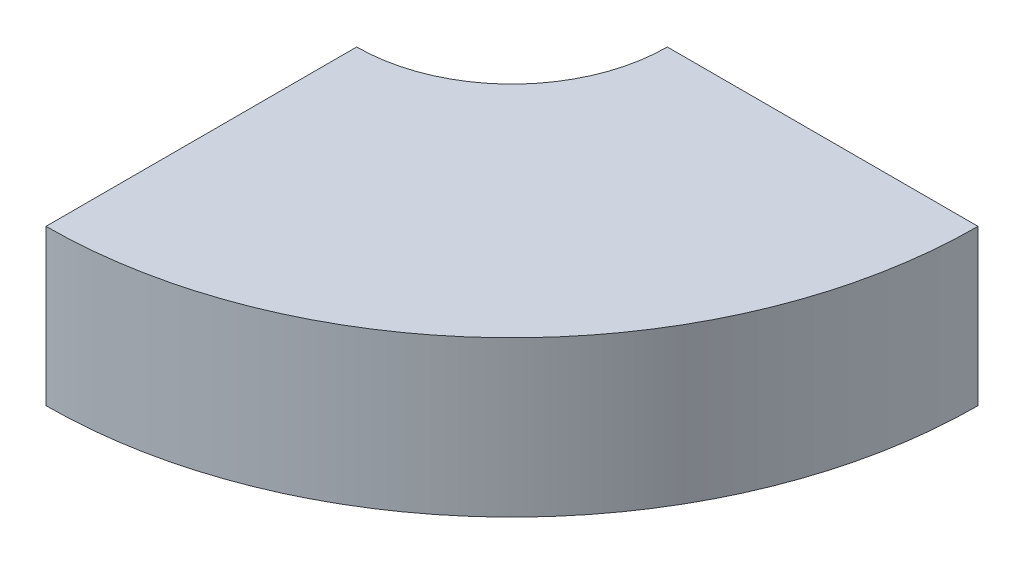
from build123d import *

# Parameters (mm, degrees)
BOSS_EXTRUDE1_DEPTH = 2


with BuildPart() as part:
    # Sketch2 → Boss-Extrude1 (new body)
    with BuildSketch(Plane(origin=(0, 0, 0), x_dir=(1, 0, 0), z_dir=(0, 1, 0))):
        with BuildLine():
            Line((6, 0), (2, 0))
            ThreePointArc((2, 0), (1.414213562, -1.414213562), (0, -2))
            Line((0, -2), (0, -6))
            ThreePointArc((0, -6), (4.242640687, -4.242640687), (6, 0))
        make_face()
    extrude(amount=BOSS_EXTRUDE1_DEPTH)


solid = part.part
